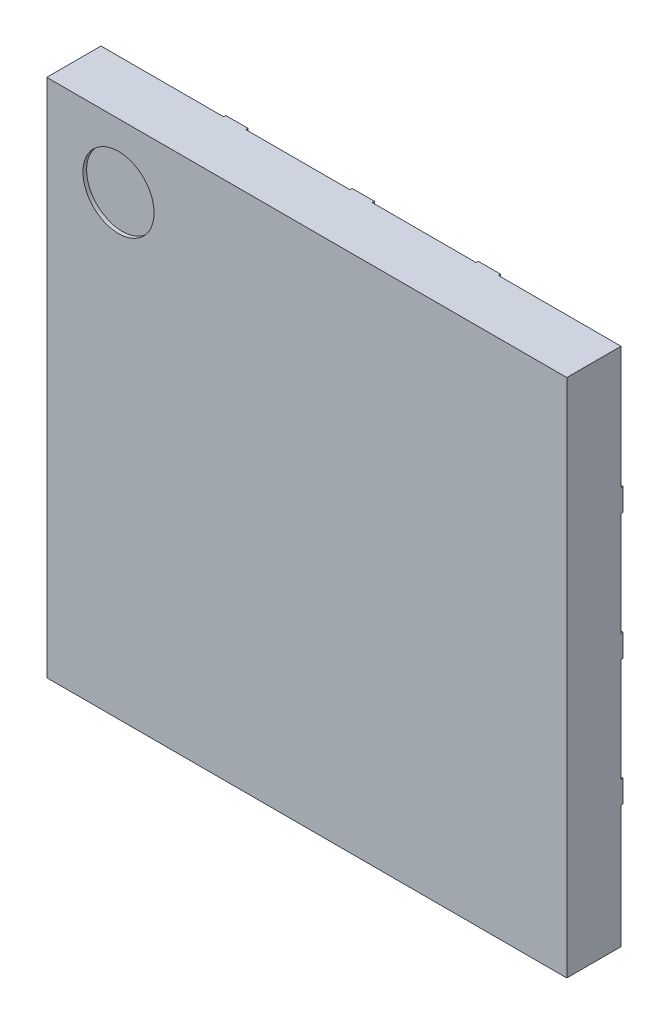
from build123d import *

# Parameters (mm, degrees)
BOSS_EXTRUDE1_START    = 0.03
SKETCH1_W              = 7
SKETCH1_H              = 7
BOSS_EXTRUDE1_DEPTH    = 0.73
SKETCH2_R              = 0.478943658
CUT_EXTRUDE1_DEPTH     = 0.05
BOSS_EXTRUDE2_DEPTH    = 0.03
SKETCH4_W              = 0.5
SKETCH4_H              = 0.3
BOSS_EXTRUDE3_DEPTH    = 0.03
FILLET1_R              = 0.15
LPATTERN1_COUNT        = 3
LPATTERN1_PITCH        = 1.7
FILLET1_OF_LPATTERN1_R = 0.15
CIRPATTERN1_DEPTH      = 0.03


# Read off the part's stored shape, not the designer's step: CirPattern1
with BuildPart() as part:
    # Sketch1 → Boss-Extrude1 (new body)
    with BuildSketch(Plane.XY.offset(BOSS_EXTRUDE1_START)):
        Rectangle(SKETCH1_W, SKETCH1_H)
    extrude(amount=BOSS_EXTRUDE1_DEPTH)

    # Sketch2 → Cut-Extrude1 (cut)
    with BuildSketch(Plane.XY.offset(0.76)):
        with Locations((-2.534351737, 2.640370435)):
            Circle(SKETCH2_R)
    extrude(amount=-CUT_EXTRUDE1_DEPTH, mode=Mode.SUBTRACT)

    # Sketch3 → Boss-Extrude2 (add)
    with BuildSketch(Plane(origin=(0, 0, 0.03), x_dir=(-1, 0, 0), z_dir=(0, 0, -1))):
        Polygon((1.1, 1.4), (1.4, 1.1), (1.4, -1.4), (-1.4, -1.4), (-1.4, 1.4), align=None)
    extrude(amount=BOSS_EXTRUDE2_DEPTH)

    # Sketch4 → Boss-Extrude3 (add)
    with BuildSketch(Plane(origin=(0, 0, 0.03), x_dir=(-1, 0, 0), z_dir=(0, 0, -1))):
        with Locations((-3.25, 1.7)):
            Rectangle(SKETCH4_W, SKETCH4_H)
    boss_extrude3 = extrude(amount=BOSS_EXTRUDE3_DEPTH)

    # Fillet1
    fillet1_edges = [part.edges().sort_by_distance(p)[0] for p in [
        (3, 1.85, 0.015),
        (3, 1.55, 0.015),
    ]]
    fillet(fillet1_edges, radius=FILLET1_R - 0.0001)  # a hair under: the kernel refuses the full size

    # LPattern1: Boss-Extrude3 ×3
    with Locations(*[(0, -i * LPATTERN1_PITCH, 0) for i in range(1, LPATTERN1_COUNT)]):
        add(boss_extrude3)

    # Fillet1 of LPattern1
    fillet1_of_lpattern1_edges = [part.edges().sort_by_distance(p)[0] for p in [
        (3, 0.15, 0.015),
        (3, -0.15, 0.015),
        (3, -1.55, 0.015),
        (3, -1.85, 0.015),
    ]]
    fillet(fillet1_of_lpattern1_edges, radius=FILLET1_OF_LPATTERN1_R - 0.0001)  # a hair under: the kernel refuses the full size

    # CirPattern1 outline → CirPattern1 (add)
    with BuildSketch(Plane.XY):
        with BuildLine():
            Line((-3.5, 1.85), (-3.5, 1.55))
            Line((-3.5, 1.55), (-3.15, 1.55))
            ThreePointArc((-3.15, 1.55), (-3.043933983, 1.593933983), (-3, 1.7))
            ThreePointArc((-3, 1.7), (-3.043933983, 1.806066017), (-3.15, 1.85))
            Line((-3.15, 1.85), (-3.5, 1.85))
        make_face()
        with BuildLine():
            Line((1.55, -3.15), (1.55, -3.5))
            Line((1.55, -3.5), (1.85, -3.5))
            Line((1.85, -3.5), (1.85, -3.15))
            ThreePointArc((1.85, -3.15), (1.806066017, -3.043933983), (1.7, -3))
            ThreePointArc((1.7, -3), (1.593933983, -3.043933983), (1.55, -3.15))
        make_face()
        with BuildLine():
            Line((-0.15, -3.15), (-0.15, -3.5))
            Line((-0.15, -3.5), (0.15, -3.5))
            Line((0.15, -3.5), (0.15, -3.15))
            ThreePointArc((0.15, -3.15), (0.106066017, -3.043933983), (0, -3))
            ThreePointArc((0, -3), (-0.106066017, -3.043933983), (-0.15, -3.15))
        make_face()
        with BuildLine():
            Line((-1.85, -3.15), (-1.85, -3.5))
            Line((-1.85, -3.5), (-1.55, -3.5))
            Line((-1.55, -3.5), (-1.55, -3.15))
            ThreePointArc((-1.55, -3.15), (-1.593933983, -3.043933983), (-1.7, -3))
            ThreePointArc((-1.7, -3), (-1.806066017, -3.043933983), (-1.85, -3.15))
        make_face()
        with BuildLine():
            Line((-3.15, -1.55), (-3.5, -1.55))
            Line((-3.5, -1.55), (-3.5, -1.85))
            Line((-3.5, -1.85), (-3.15, -1.85))
            ThreePointArc((-3.15, -1.85), (-3.043933983, -1.806066017), (-3, -1.7))
            ThreePointArc((-3, -1.7), (-3.043933983, -1.593933983), (-3.15, -1.55))
        make_face()
        with BuildLine():
            Line((-3.15, 0.15), (-3.5, 0.15))
            Line((-3.5, 0.15), (-3.5, -0.15))
            Line((-3.5, -0.15), (-3.15, -0.15))
            ThreePointArc((-3.15, -0.15), (-3.043933983, -0.106066017), (-3, 0))
            ThreePointArc((-3, 0), (-3.043933983, 0.106066017), (-3.15, 0.15))
        make_face()
        with BuildLine():
            Line((1.85, 3.5), (1.55, 3.5))
            Line((1.55, 3.5), (1.55, 3.15))
            ThreePointArc((1.55, 3.15), (1.593933983, 3.043933983), (1.7, 3))
            ThreePointArc((1.7, 3), (1.806066017, 3.043933983), (1.85, 3.15))
            Line((1.85, 3.15), (1.85, 3.5))
        make_face()
        with BuildLine():
            Line((0.15, 3.5), (-0.15, 3.5))
            Line((-0.15, 3.5), (-0.15, 3.15))
            ThreePointArc((-0.15, 3.15), (-0.106066017, 3.043933983), (0, 3))
            ThreePointArc((0, 3), (0.106066017, 3.043933983), (0.15, 3.15))
            Line((0.15, 3.15), (0.15, 3.5))
        make_face()
        with BuildLine():
            Line((-1.55, 3.5), (-1.85, 3.5))
            Line((-1.85, 3.5), (-1.85, 3.15))
            ThreePointArc((-1.85, 3.15), (-1.806066017, 3.043933983), (-1.7, 3))
            ThreePointArc((-1.7, 3), (-1.593933983, 3.043933983), (-1.55, 3.15))
            Line((-1.55, 3.15), (-1.55, 3.5))
        make_face()
    extrude(amount=CIRPATTERN1_DEPTH)


solid = part.part
